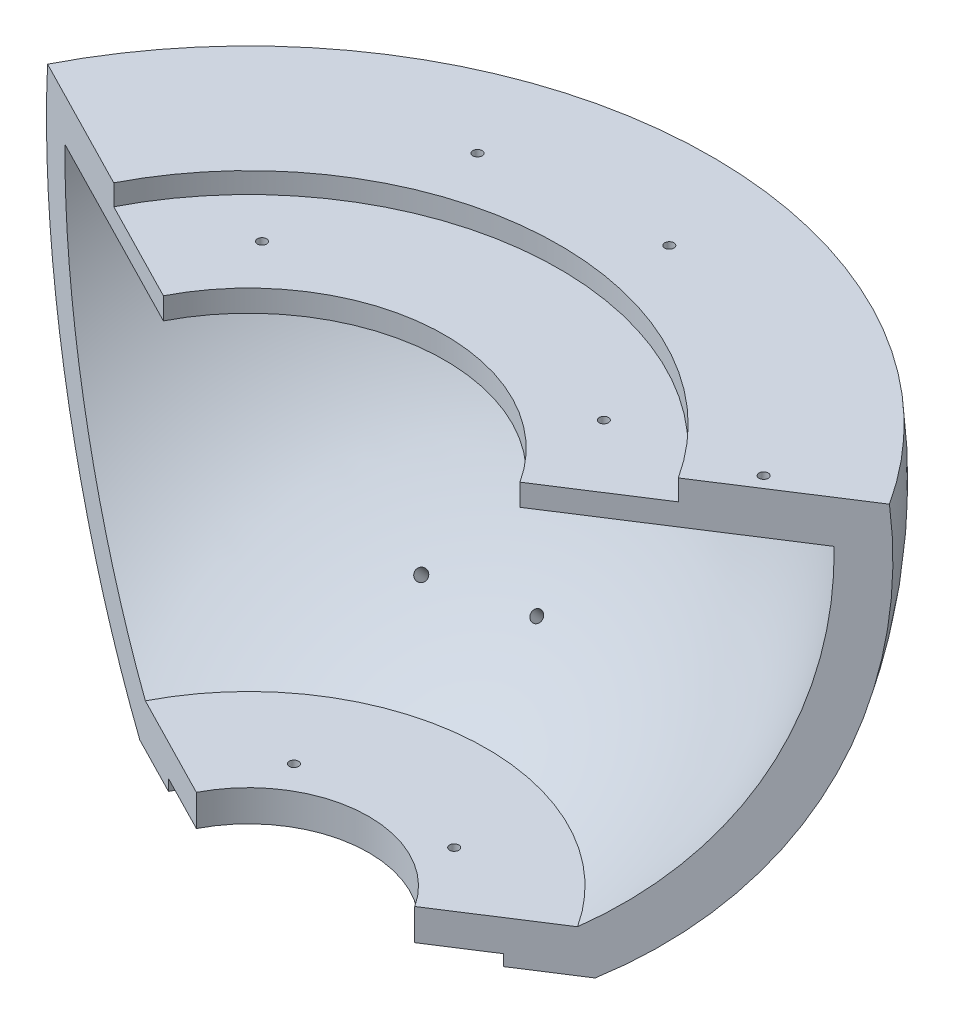
from build123d import *

# Parameters (mm, degrees)
ENL_V_MAT_EXTRU_1_DEPTH  = 205
ESQUISSE4_W              = 219.421497641
ESQUISSE4_H              = 186.787380576
ENL_V_MAT_EXTRU_2_DEPTH  = 241.082722882
COQUE2_T                 = -10
ENL_V_MAT_EXTRU_4_DEPTH  = 5
ENL_V_MAT_EXTRU_5_DEPTH  = 25
ENL_V_MAT_EXTRU_6_DEPTH  = 2.5
ENL_V_MAT_EXTRU_10_DEPTH = 15
ECHELLE1_SCALE           = 1.15
TROU_TARAUD_M32_D        = 2.5
TROU_TARAUD_M32_DEPTH    = 12.5
TROU_TARAUD_M32_TIP      = 0.751075774
TROU_TARAUD_M33_D        = 2.5
TROU_TARAUD_M33_DEPTH    = 12.5
TROU_TARAUD_M33_TIP      = 0.751075774
TROU_TARAUD_M35_D        = 2.5
TROU_TARAUD_M35_DEPTH    = 12.5
TROU_TARAUD_M35_TIP      = 0.751075774
ESQUISSE23_R             = 1.5
ENL_V_MAT_EXTRU_11_DEPTH = 40


with BuildPart() as part:
    # Esquisse1 → Révolution2 (revolve)
    with BuildSketch(Plane.XY):
        with BuildLine():
            Line((0.334149559, -92.625367455), (0.334149559, 171))
            ThreePointArc((0.334149559, 171), (43.341663836, 173.345331392), (83, 190.148998741))
            ThreePointArc((83, 190.148998741), (97.133928161, 161.990328143), (102, 130.86156331))
            add(Edge.make_bspline(
                [(102, 130.86156331), (103.479009077, 113.684745488), (71.205293421, 65.560678141), (110.707376512, 34.252457406), (109.358599643, 11.86156331)],
                knots=[0, 0, 0, 0, 0.406612523, 1, 1, 1, 1], degree=3))
            ThreePointArc((109.358599643, 11.86156331), (99.215374733, -47.500625433), (59.334149559, -92.625367455))
            Line((59.334149559, -92.625367455), (0.334149559, -92.625367455))
        make_face()
    revolve(axis=Axis((0.334149559, -92.625367455, 0), (0, 1, 0)))

    # Esquisse3 → Enlèv. mat.-Extru.1 (cut, symmetric)
    with BuildSketch(Plane(origin=(0, 0, 0), x_dir=(1, 0, 0), z_dir=(0, 1, 0))):
        with BuildLine():
            Line((-97.244399695, 50.050229554), (0.334149559, 0))
            Line((0.334149559, 0), (92.468194445, 59.480387742))
            ThreePointArc((92.468194445, 59.480387742), (5.778653928, -109.530617295), (-97.244399695, 50.050229554))
        make_face()
    extrude(amount=ENL_V_MAT_EXTRU_1_DEPTH, both=True, mode=Mode.SUBTRACT)

    # Esquisse4 → Enlèv. mat.-Extru.2 (cut, through all)
    with BuildSketch(Plane.XY):
        with Locations((-2.038050308, 104.768322833)):
            Rectangle(ESQUISSE4_W, ESQUISSE4_H)
    extrude(amount=-ENL_V_MAT_EXTRU_2_DEPTH, mode=Mode.SUBTRACT)

    # Coque2
    coque2_openings = [part.faces().sort_by_distance(p)[0] for p in [
        (41.688799169, -36.484898267, -26.697955102),
        (-43.464282683, -36.484897866, -22.465199622),
    ]]
    offset(amount=COQUE2_T, openings=coque2_openings, kind=Kind.INTERSECTION)

    # Esquisse6 → Enlèv. mat.-Extru.4 (cut)
    with BuildSketch(Plane(origin=(0, 11.5, 0), x_dir=(1, 0, 0), z_dir=(0, 1, 0))):
        with BuildLine():
            Line((-64.751451353, 33.383866548), (0.334149559, 0))
            Line((0.334149559, 0), (61.788226523, 39.673850536))
            ThreePointArc((61.788226523, 39.673850536), (-3.29737439, 73.057717085), (-64.751451353, 33.383866548))
        make_face()
    extrude(amount=-ENL_V_MAT_EXTRU_4_DEPTH, mode=Mode.SUBTRACT)

    # Esquisse7 → Enlèv. mat.-Extru.5 (cut)
    with BuildSketch(Plane(origin=(0, 11.5, 0), x_dir=(1, 0, 0), z_dir=(0, 1, 0))):
        with BuildLine():
            Line((-40.77485255, 21.085730501), (0.334149559, 0))
            Line((0.334149559, 0), (39.149428885, 25.0585749))
            ThreePointArc((39.149428885, 25.0585749), (-1.959573224, 46.144305401), (-40.77485255, 21.085730501))
        make_face()
    extrude(amount=-ENL_V_MAT_EXTRU_5_DEPTH, mode=Mode.SUBTRACT)

    # Esquisse8 → Enlèv. mat.-Extru.6 (cut, symmetric)
    with BuildSketch(Plane(origin=(0, -92.5, 0), x_dir=(1, 0, 0), z_dir=(0, 1, 0))):
        with BuildLine():
            Line((36.828161908, 23.559998993), (0.334149559, 0))
            Line((0.334149559, 0), (-38.316414256, 19.824742283))
            ThreePointArc((-38.316414256, 19.824742283), (-1.822401908, 43.384741276), (36.828161908, 23.559998993))
        make_face()
    extrude(amount=ENL_V_MAT_EXTRU_6_DEPTH, both=True, mode=Mode.SUBTRACT)

    # Esquisse10 → Enlèv. mat.-Extru.10 (cut)
    with BuildSketch(Plane(origin=(0, -92.5, 0), x_dir=(1, 0, 0), z_dir=(0, 1, 0))):
        with BuildLine():
            Line((-24.838107184, 12.911415859), (0.334149559, 0))
            Line((0.334149559, 0), (24.101892064, 15.344105881))
            ThreePointArc((24.101892064, 15.344105881), (-1.070364679, 28.25552174), (-24.838107184, 12.911415859))
        make_face()
    extrude(amount=ENL_V_MAT_EXTRU_10_DEPTH, mode=Mode.SUBTRACT)


with BuildPart() as part_1:
    # Echelle1: scaled about (-3.205196898, -32.62107135, -71.203315854)
    add(part.part.scale(ECHELLE1_SCALE).moved(Location((0.480779535, 4.893160702, 10.680497378))))

    # Trou taraudé M32
    with Locations(Plane(origin=(-21.564432755, -98.60683867, -24.05170562), x_dir=(0, 0, -1), z_dir=(0, -1, 0))):
        with Locations((0, 0), (2.053122984, 41.304003571)):
            Hole(TROU_TARAUD_M32_D / 2, depth=TROU_TARAUD_M32_DEPTH)
            with Locations((0, 0, -(TROU_TARAUD_M32_DEPTH + TROU_TARAUD_M32_TIP / 2))):  # 118° drill point
                Cone(0, TROU_TARAUD_M32_D / 2, TROU_TARAUD_M32_TIP, mode=Mode.SUBTRACT)

    # Trou taraudé M33
    with Locations(Plane(origin=(-45.802285112, 12.36816133, -39.635090601), x_dir=(0, 0, 1), z_dir=(0, 1, 0))):
        with Locations((0, 0), (-4.379976461, 88.114820569)):
            Hole(TROU_TARAUD_M33_D / 2, depth=TROU_TARAUD_M33_DEPTH)
            with Locations((0, 0, -(TROU_TARAUD_M33_DEPTH + TROU_TARAUD_M33_TIP / 2))):  # 118° drill point
                Cone(0, TROU_TARAUD_M33_D / 2, TROU_TARAUD_M33_TIP, mode=Mode.SUBTRACT)

    # Trou taraudé M35
    with Locations(Plane(origin=(82.53934023, 17.973988757, -47.019680031), x_dir=(1, 0, 0), z_dir=(0, 1, 0))):
        with Locations((0, 0), (-66.69965831, 41.172267137), (-114.254701281, 36.84355094)):
            Hole(TROU_TARAUD_M35_D / 2, depth=TROU_TARAUD_M35_DEPTH)
            with Locations((0, 0, -(TROU_TARAUD_M35_DEPTH + TROU_TARAUD_M35_TIP / 2))):  # 118° drill point
                Cone(0, TROU_TARAUD_M35_D / 2, TROU_TARAUD_M35_TIP, mode=Mode.SUBTRACT)

    # Esquisse23 → Enlèv. mat.-Extru.11 (cut)
    with BuildSketch(Plane(origin=(-19.273619273, -89.804688212, -82.066838873), x_dir=(-0.9876815415012294, 0.1155106334721785, 0.10555788048559506), z_dir=(-0.15647738679360396, -0.7291003694870504, -0.6662788294971496))):
        with Locations((-10.604108873, 5.618400934)):
            Circle(ESQUISSE23_R)
        with Locations((15.022911638, 1.230255574)):
            Circle(ESQUISSE23_R)
    extrude(amount=-ENL_V_MAT_EXTRU_11_DEPTH, mode=Mode.SUBTRACT)


solid = part_1.part
